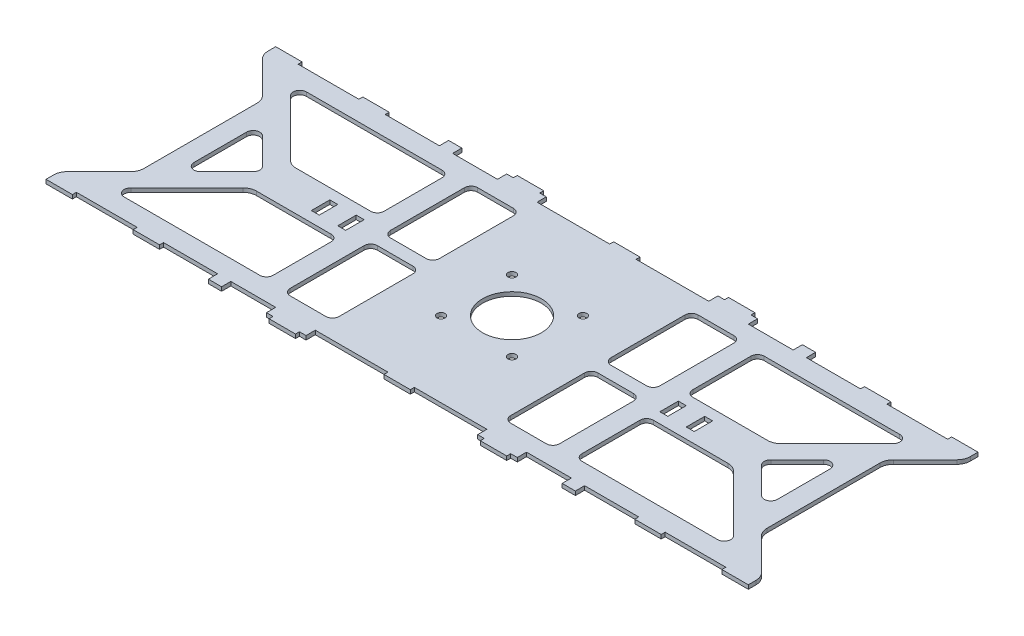
from build123d import *

# Parameters (mm, degrees)
SZKIC1_R                    = 3
DODANIE_WYCI_GNI_CIE1_DEPTH = 3


with BuildPart() as part:
    # Szkic1 → Dodanie-wyciągnięcie1 (new body)
    with BuildSketch(Plane(origin=(0, 0, 0), x_dir=(1, 0, 0), z_dir=(0, 1, 0))):
        with BuildLine():
            Line((263.071067812, -74.071067812), (238.928932188, -49.928932188))
            ThreePointArc((238.928932188, -49.928932188), (236.761204675, -46.6846987), (236, -42.857864376))
            Line((236, -42.857864376), (236, 0))
            Line((236, 0), (236, 42.857864376))
            ThreePointArc((236, 42.857864376), (236.761204675, 46.6846987), (238.928932188, 49.928932188))
            Line((238.928932188, 49.928932188), (263.071067812, 74.071067812))
            ThreePointArc((263.071067812, 74.071067812), (265.238795325, 77.3153013), (266, 81.142135624))
            Line((266, 81.142135624), (266, 87))
            Line((266, 87), (246, 87))
            Line((246, 87), (246, 84))
            Line((246, 84), (200, 84))
            Line((200, 84), (200, 87))
            Line((200, 87), (180, 87))
            Line((180, 87), (180, 84))
            Line((180, 84), (139, 84))
            Line((139, 84), (139, 91))
            Line((139, 91), (129, 91))
            Line((129, 91), (129, 84))
            Line((129, 84), (95, 84))
            Line((95, 84), (95, 91))
            Line((95, 91), (90, 91))
            Line((90, 91), (90, 94))
            Line((90, 94), (70, 94))
            Line((70, 94), (70, 91))
            Line((70, 91), (65, 91))
            Line((65, 91), (65, 84))
            Line((65, 84), (10, 84))
            Line((10, 84), (10, 87))
            Line((10, 87), (0, 87))
            Line((0, 87), (-10, 87))
            Line((-10, 87), (-10, 84))
            Line((-10, 84), (-65, 84))
            Line((-65, 84), (-65, 91))
            Line((-65, 91), (-70, 91))
            Line((-70, 91), (-70, 94))
            Line((-70, 94), (-90, 94))
            Line((-90, 94), (-90, 91))
            Line((-90, 91), (-95, 91))
            Line((-95, 91), (-95, 84))
            Line((-95, 84), (-129, 84))
            Line((-129, 84), (-129, 91))
            Line((-129, 91), (-139, 91))
            Line((-139, 91), (-139, 84))
            Line((-139, 84), (-180, 84))
            Line((-180, 84), (-180, 87))
            Line((-180, 87), (-200, 87))
            Line((-200, 87), (-200, 84))
            Line((-200, 84), (-246, 84))
            Line((-246, 84), (-246, 87))
            Line((-246, 87), (-266, 87))
            Line((-266, 87), (-266, 81.142135624))
            ThreePointArc((-266, 81.142135624), (-265.238795325, 77.3153013), (-263.071067812, 74.071067812))
            Line((-263.071067812, 74.071067812), (-238.928932188, 49.928932188))
            ThreePointArc((-238.928932188, 49.928932188), (-236.761204675, 46.6846987), (-236, 42.857864376))
            Line((-236, 42.857864376), (-236, 0))
            Line((-236, 0), (-236, -42.857864376))
            ThreePointArc((-236, -42.857864376), (-236.761204675, -46.6846987), (-238.928932188, -49.928932188))
            Line((-238.928932188, -49.928932188), (-263.071067812, -74.071067812))
            ThreePointArc((-263.071067812, -74.071067812), (-265.238795325, -77.3153013), (-266, -81.142135624))
            Line((-266, -81.142135624), (-266, -87))
            Line((-266, -87), (-246, -87))
            Line((-246, -87), (-246, -84))
            Line((-246, -84), (-200, -84))
            Line((-200, -84), (-200, -87))
            Line((-200, -87), (-180, -87))
            Line((-180, -87), (-180, -84))
            Line((-180, -84), (-139, -84))
            Line((-139, -84), (-139, -91))
            Line((-139, -91), (-129, -91))
            Line((-129, -91), (-129, -84))
            Line((-129, -84), (-95, -84))
            Line((-95, -84), (-95, -91))
            Line((-95, -91), (-90, -91))
            Line((-90, -91), (-90, -94))
            Line((-90, -94), (-70, -94))
            Line((-70, -94), (-70, -91))
            Line((-70, -91), (-65, -91))
            Line((-65, -91), (-65, -84))
            Line((-65, -84), (-10, -84))
            Line((-10, -84), (-10, -87))
            Line((-10, -87), (0, -87))
            Line((0, -87), (10, -87))
            Line((10, -87), (10, -84))
            Line((10, -84), (65, -84))
            Line((65, -84), (65, -91))
            Line((65, -91), (70, -91))
            Line((70, -91), (70, -94))
            Line((70, -94), (90, -94))
            Line((90, -94), (90, -91))
            Line((90, -91), (95, -91))
            Line((95, -91), (95, -84))
            Line((95, -84), (129, -84))
            Line((129, -84), (129, -91))
            Line((129, -91), (139, -91))
            Line((139, -91), (139, -84))
            Line((139, -84), (180, -84))
            Line((180, -84), (180, -87))
            Line((180, -87), (200, -87))
            Line((200, -87), (200, -84))
            Line((200, -84), (246, -84))
            Line((246, -84), (246, -87))
            Line((246, -87), (266, -87))
            Line((266, -87), (266, -81.142135624))
            ThreePointArc((266, -81.142135624), (265.238795325, -77.3153013), (263.071067812, -74.071067812))
        make_face()
        with Locations((26.870057685, -26.870057685)):
            Circle(SZKIC1_R, mode=Mode.SUBTRACT)
        with Locations((26.870057685, 26.870057685)):
            Circle(SZKIC1_R, mode=Mode.SUBTRACT)
        with Locations((-26.870057685, 26.870057685)):
            Circle(SZKIC1_R, mode=Mode.SUBTRACT)
        with Locations((-26.870057685, -26.870057685)):
            Circle(SZKIC1_R, mode=Mode.SUBTRACT)
        Polygon((145, 0), (145, -7), (139, -7), (139, 0), (139, 7), (145, 7), align=None, mode=Mode.SUBTRACT)
        Polygon((125, -7), (119, -7), (119, 0), (119, 7), (125, 7), (125, 0), align=None, mode=Mode.SUBTRACT)
        with BuildLine():
            Line((65, -10), (65, -66))
            ThreePointArc((65, -66), (66.464466094, -69.535533906), (70, -71))
            Line((70, -71), (97, -71))
            ThreePointArc((97, -71), (100.535533906, -69.535533906), (102, -66))
            Line((102, -66), (102, -10))
            ThreePointArc((102, -10), (100.535533906, -6.464466094), (97, -5))
            Line((97, -5), (70, -5))
            ThreePointArc((70, -5), (66.464466094, -6.464466094), (65, -10))
        make_face(mode=Mode.SUBTRACT)
        with BuildLine():
            Line((178.644660941, -15), (122, -15))
            ThreePointArc((122, -15), (118.464466094, -16.464466094), (117, -20))
            Line((117, -20), (117, -64))
            ThreePointArc((117, -64), (118.464466094, -67.535533906), (122, -69))
            Line((122, -69), (224.715728753, -69))
            ThreePointArc((224.715728753, -69), (229.335126415, -65.913417162), (228.251262658, -60.464466094))
            Line((228.251262658, -60.464466094), (185.715728753, -17.928932188))
            ThreePointArc((185.715728753, -17.928932188), (182.471495264, -15.761204675), (178.644660941, -15))
        make_face(mode=Mode.SUBTRACT)
        with BuildLine():
            Line((212.464466094, -23.464466094), (192.535533906, -3.535533906))
            ThreePointArc((192.535533906, -3.535533906), (191.451670149, -1.913417162), (191.071067812, 0))
            ThreePointArc((191.071067812, 0), (191.451670149, 1.913417162), (192.535533906, 3.535533906))
            Line((192.535533906, 3.535533906), (212.464466094, 23.464466094))
            ThreePointArc((212.464466094, 23.464466094), (217.913417162, 24.548329851), (221, 19.928932188))
            Line((221, 19.928932188), (221, 0))
            Line((221, 0), (221, -19.928932188))
            ThreePointArc((221, -19.928932188), (217.913417162, -24.548329851), (212.464466094, -23.464466094))
        make_face(mode=Mode.SUBTRACT)
        with BuildLine():
            Line((65, 10), (65, 66))
            ThreePointArc((65, 66), (66.464466094, 69.535533906), (70, 71))
            Line((70, 71), (97, 71))
            ThreePointArc((97, 71), (100.535533906, 69.535533906), (102, 66))
            Line((102, 66), (102, 10))
            ThreePointArc((102, 10), (100.535533906, 6.464466094), (97, 5))
            Line((97, 5), (70, 5))
            ThreePointArc((70, 5), (66.464466094, 6.464466094), (65, 10))
        make_face(mode=Mode.SUBTRACT)
        with BuildLine():
            Line((178.644660941, 15), (122, 15))
            ThreePointArc((122, 15), (118.464466094, 16.464466094), (117, 20))
            Line((117, 20), (117, 64))
            ThreePointArc((117, 64), (118.464466094, 67.535533906), (122, 69))
            Line((122, 69), (224.715728753, 69))
            ThreePointArc((224.715728753, 69), (229.335126415, 65.913417162), (228.251262658, 60.464466094))
            Line((228.251262658, 60.464466094), (185.715728753, 17.928932188))
            ThreePointArc((185.715728753, 17.928932188), (182.471495264, 15.761204675), (178.644660941, 15))
        make_face(mode=Mode.SUBTRACT)
        Polygon((-145, 0), (-145, 7), (-139, 7), (-139, 0), (-139, -7), (-145, -7), align=None, mode=Mode.SUBTRACT)
        Polygon((-125, 7), (-119, 7), (-119, 0), (-119, -7), (-125, -7), (-125, 0), align=None, mode=Mode.SUBTRACT)
        with BuildLine():
            Line((-65, 10), (-65, 66))
            ThreePointArc((-65, 66), (-66.464466094, 69.535533906), (-70, 71))
            Line((-70, 71), (-97, 71))
            ThreePointArc((-97, 71), (-100.535533906, 69.535533906), (-102, 66))
            Line((-102, 66), (-102, 10))
            ThreePointArc((-102, 10), (-100.535533906, 6.464466094), (-97, 5))
            Line((-97, 5), (-70, 5))
            ThreePointArc((-70, 5), (-66.464466094, 6.464466094), (-65, 10))
        make_face(mode=Mode.SUBTRACT)
        with BuildLine():
            Line((-178.644660941, 15), (-122, 15))
            ThreePointArc((-122, 15), (-118.464466094, 16.464466094), (-117, 20))
            Line((-117, 20), (-117, 64))
            ThreePointArc((-117, 64), (-118.464466094, 67.535533906), (-122, 69))
            Line((-122, 69), (-224.715728753, 69))
            ThreePointArc((-224.715728753, 69), (-229.335126415, 65.913417162), (-228.251262659, 60.464466094))
            Line((-228.251262659, 60.464466094), (-185.715728753, 17.928932188))
            ThreePointArc((-185.715728753, 17.928932188), (-182.471495264, 15.761204675), (-178.644660941, 15))
        make_face(mode=Mode.SUBTRACT)
        with BuildLine():
            Line((-212.464466094, 23.464466094), (-192.535533906, 3.535533906))
            ThreePointArc((-192.535533906, 3.535533906), (-191.451670149, 1.913417162), (-191.071067812, 0))
            ThreePointArc((-191.071067812, 0), (-191.451670149, -1.913417162), (-192.535533906, -3.535533906))
            Line((-192.535533906, -3.535533906), (-212.464466094, -23.464466094))
            ThreePointArc((-212.464466094, -23.464466094), (-217.913417162, -24.548329851), (-221, -19.928932188))
            Line((-221, -19.928932188), (-221, 0))
            Line((-221, 0), (-221, 19.928932188))
            ThreePointArc((-221, 19.928932188), (-217.913417162, 24.548329851), (-212.464466094, 23.464466094))
        make_face(mode=Mode.SUBTRACT)
        with BuildLine():
            Line((-65, -10), (-65, -66))
            ThreePointArc((-65, -66), (-66.464466094, -69.535533906), (-70, -71))
            Line((-70, -71), (-97, -71))
            ThreePointArc((-97, -71), (-100.535533906, -69.535533906), (-102, -66))
            Line((-102, -66), (-102, -10))
            ThreePointArc((-102, -10), (-100.535533906, -6.464466094), (-97, -5))
            Line((-97, -5), (-70, -5))
            ThreePointArc((-70, -5), (-66.464466094, -6.464466094), (-65, -10))
        make_face(mode=Mode.SUBTRACT)
        with BuildLine():
            Line((-178.644660941, -15), (-122, -15))
            ThreePointArc((-122, -15), (-118.464466094, -16.464466094), (-117, -20))
            Line((-117, -20), (-117, -64))
            ThreePointArc((-117, -64), (-118.464466094, -67.535533906), (-122, -69))
            Line((-122, -69), (-224.715728753, -69))
            ThreePointArc((-224.715728753, -69), (-229.335126415, -65.913417162), (-228.251262659, -60.464466094))
            Line((-228.251262659, -60.464466094), (-185.715728753, -17.928932188))
            ThreePointArc((-185.715728753, -17.928932188), (-182.471495264, -15.761204675), (-178.644660941, -15))
        make_face(mode=Mode.SUBTRACT)
        with BuildLine():
            ThreePointArc((0, -22.3), (15.76848122, -15.76848122), (22.3, 0))
            ThreePointArc((22.3, 0), (15.76848122, 15.76848122), (0, 22.3))
            ThreePointArc((0, 22.3), (-15.76848122, 15.76848122), (-22.3, 0))
            ThreePointArc((-22.3, 0), (-15.76848122, -15.76848122), (0, -22.3))
        make_face(mode=Mode.SUBTRACT)
    extrude(amount=DODANIE_WYCI_GNI_CIE1_DEPTH)


solid = part.part
